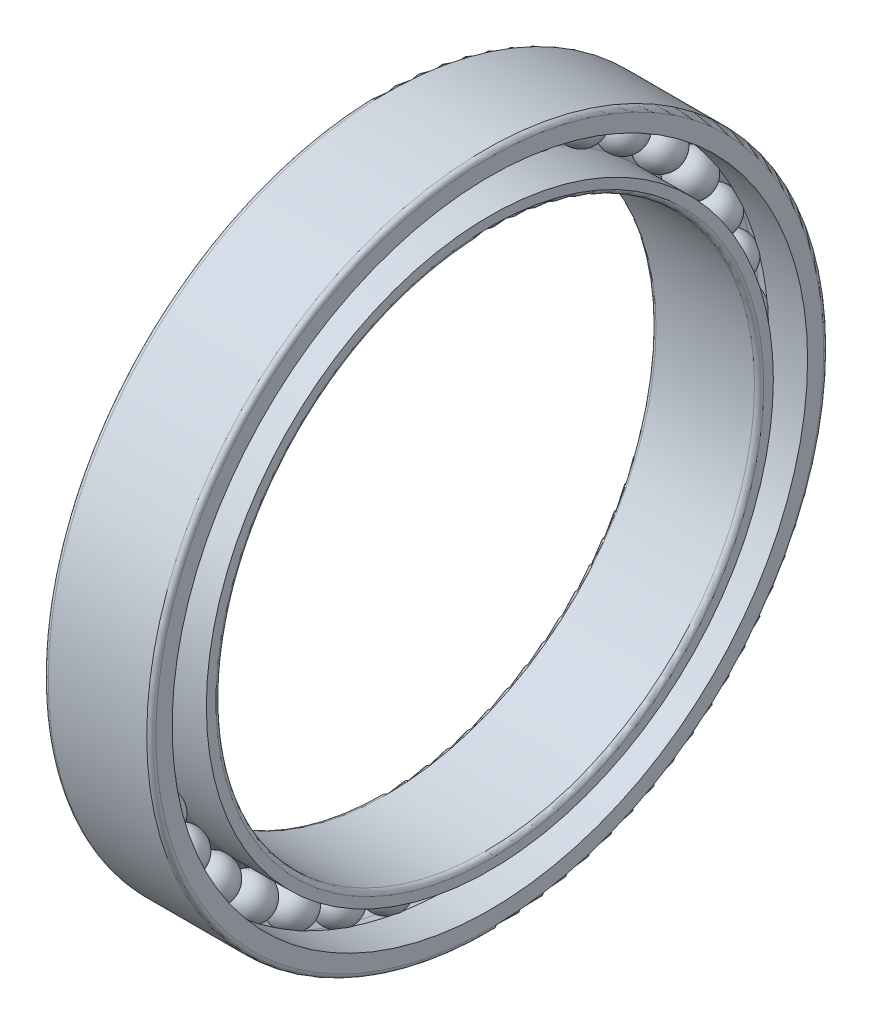
from build123d import *

# Parameters (mm, degrees)
CAGSPISKE_W         = 0.675
CAGSPISKE_H         = 0.45
CAGESPINE_ANGLE     = 0.001
BALLSDETAILED_COUNT = 38
BALLSDETAILED_ANGLE = 350.526315789


with BuildPart() as part:
    # CagSpiSke → CageSpine (revolve)
    with BuildSketch(Plane.XY):
        with Locations((0, 19.75)):
            Rectangle(CAGSPISKE_W, CAGSPISKE_H)
    revolve(axis=Axis((-20.6375, 0, 0), (1, 0, 0)), revolution_arc=CAGESPINE_ANGLE)

    # BalDetSke → BallDetailed (revolve)
    with BuildSketch(Plane.XY):
        with BuildLine():
            Line((-1.35, 19.75), (1.35, 19.75))
            ThreePointArc((1.35, 19.75), (0, 18.4), (-1.35, 19.75))
        make_face()
    balldetailed = revolve(axis=Axis((-1.905, 19.75, 0), (1, 0, 0)))

    # InnRacSke → InnerRace (revolve)
    with BuildSketch(Plane.XY):
        with BuildLine():
            Line((-0.972432517, 18.85), (-3.5, 18.85))
            Line((-3.5, 18.85), (-3.5, 17.8))
            ThreePointArc((-3.5, 17.8), (-3.412132034, 17.587867966), (-3.2, 17.5))
            Line((-3.2, 17.5), (3.2, 17.5))
            ThreePointArc((3.2, 17.5), (3.412132034, 17.587867966), (3.5, 17.8))
            Line((3.5, 17.8), (3.5, 18.425))
            Line((3.5, 18.425), (0, 18.425))
            ThreePointArc((0, 18.425), (-0.530624632, 18.535890244), (-0.972432517, 18.85))
        make_face()
    revolve(axis=Axis((-20.6375, 0, 0), (1, 0, 0)))

    # OutRacSke → OuterRace (revolve)
    with BuildSketch(Plane.XY):
        with BuildLine():
            Line((0, 21.075), (-3.5, 21.075))
            Line((-3.5, 21.075), (-3.5, 21.7))
            ThreePointArc((-3.5, 21.7), (-3.412132034, 21.912132034), (-3.2, 22))
            Line((-3.2, 22), (3.2, 22))
            ThreePointArc((3.2, 22), (3.412132034, 21.912132034), (3.5, 21.7))
            Line((3.5, 21.7), (3.5, 20.65))
            Line((3.5, 20.65), (0.972432517, 20.65))
            ThreePointArc((0.972432517, 20.65), (0.530624632, 20.964109756), (0, 21.075))
        make_face()
    revolve(axis=Axis((-20.6375, 0, 0), (1, 0, 0)))

    # BallsDetailed: BallDetailed ×38 about axis
    ballsdetailed_axis = Axis((-50, 0, 0), (1, 0, 0))
    for i in range(1, BALLSDETAILED_COUNT):
        add(balldetailed.rotate(ballsdetailed_axis, i * BALLSDETAILED_ANGLE / (BALLSDETAILED_COUNT - 1)))


solid = part.part
